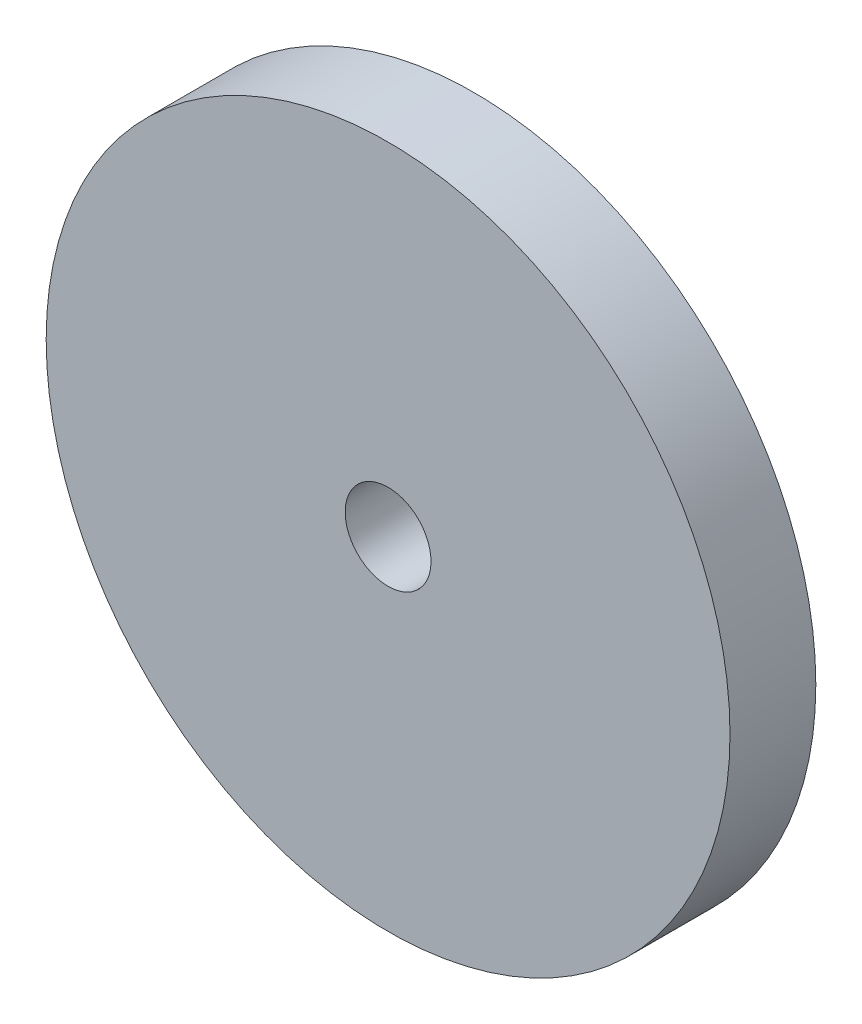
from build123d import *

# Parameters (mm, degrees)
SKETCH1_R           = 202.4
SKETCH1_R_2         = 25.4
BOSS_EXTRUDE1_DEPTH = 50.8


with BuildPart() as part:
    # Sketch1 → Boss-Extrude1 (new body)
    with BuildSketch(Plane.XY):
        Circle(SKETCH1_R)
        Circle(SKETCH1_R_2, mode=Mode.SUBTRACT)
    extrude(amount=BOSS_EXTRUDE1_DEPTH)


solid = part.part
